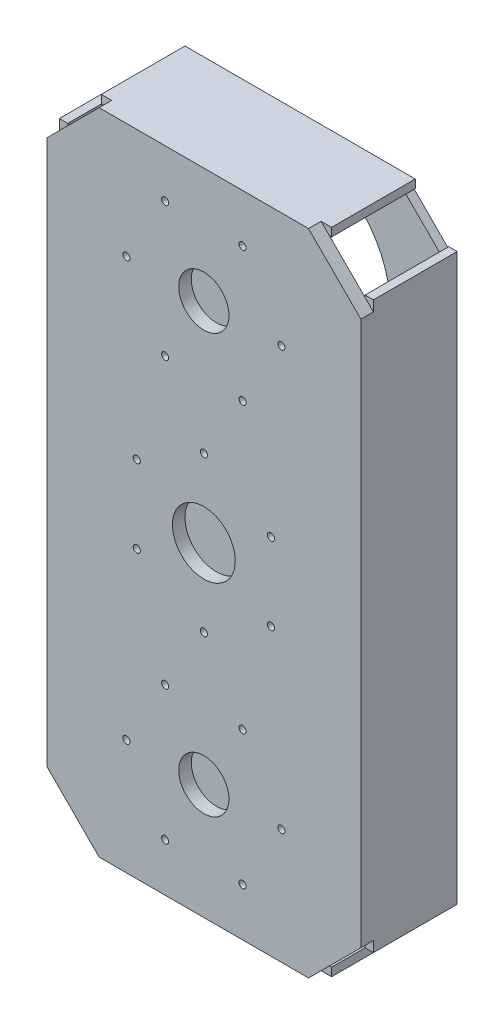
from build123d import *

# Parameters (mm, degrees)
SK_TOP_PLATE_R      = 1.7
SK_TOP_PLATE_R_2    = 12
SK_TOP_PLATE_R_3    = 15
TOP_PLATE_DEPTH     = 6
SK_FRONT_WALL_W     = 40
SK_FRONT_WALL_H     = 270
FRONT_WALL_DEPTH    = 4
SK_BACK_WALL_W      = 40
SK_BACK_WALL_H      = 270
BACK_WALL_DEPTH     = 4
SK_LEFT_WALL_W      = 110
SK_LEFT_WALL_H      = 40
LEFT_WALL_DEPTH     = 4
SK_RIGHT_WALL_W     = 110
SK_RIGHT_WALL_H     = 40
RIGHT_WALL_DEPTH    = 4
SK_BOTTOM_PLATE_R   = 47
SK_BOTTOM_PLATE_R_2 = 20
BOTTOM_PLATE_DEPTH  = 4


with BuildPart() as part:
    # SK_Top_Plate → Top_Plate (new body)
    with BuildSketch(Plane.XY.offset(131)):
        Polygon((-50, -155), (50, -155), (75, -130), (75, 130), (50, 155), (-50, 155), (-75, 130), (-75, -130), align=None)
        with Locations((37, 100)):
            Circle(SK_TOP_PLATE_R, mode=Mode.SUBTRACT)
        with Locations((18.5, 132.04293994)):
            Circle(SK_TOP_PLATE_R, mode=Mode.SUBTRACT)
        with Locations((-18.5, 132.04293994)):
            Circle(SK_TOP_PLATE_R, mode=Mode.SUBTRACT)
        with Locations((-37, 100)):
            Circle(SK_TOP_PLATE_R, mode=Mode.SUBTRACT)
        with Locations((-18.5, 67.95706006)):
            Circle(SK_TOP_PLATE_R, mode=Mode.SUBTRACT)
        with Locations((18.5, 67.95706006)):
            Circle(SK_TOP_PLATE_R, mode=Mode.SUBTRACT)
        with Locations((0, 100)):
            Circle(SK_TOP_PLATE_R_2, mode=Mode.SUBTRACT)
        with Locations((37, -100)):
            Circle(SK_TOP_PLATE_R, mode=Mode.SUBTRACT)
        with Locations((18.5, -67.95706006)):
            Circle(SK_TOP_PLATE_R, mode=Mode.SUBTRACT)
        with Locations((-18.5, -67.95706006)):
            Circle(SK_TOP_PLATE_R, mode=Mode.SUBTRACT)
        with Locations((-37, -100)):
            Circle(SK_TOP_PLATE_R, mode=Mode.SUBTRACT)
        with Locations((-18.5, -132.04293994)):
            Circle(SK_TOP_PLATE_R, mode=Mode.SUBTRACT)
        with Locations((18.5, -132.04293994)):
            Circle(SK_TOP_PLATE_R, mode=Mode.SUBTRACT)
        with Locations((0, -100)):
            Circle(SK_TOP_PLATE_R_2, mode=Mode.SUBTRACT)
        with Locations((32.04293994, 18.5)):
            Circle(SK_TOP_PLATE_R, mode=Mode.SUBTRACT)
        with Locations((0, 37)):
            Circle(SK_TOP_PLATE_R, mode=Mode.SUBTRACT)
        with Locations((-32.04293994, 18.5)):
            Circle(SK_TOP_PLATE_R, mode=Mode.SUBTRACT)
        with Locations((-32.04293994, -18.5)):
            Circle(SK_TOP_PLATE_R, mode=Mode.SUBTRACT)
        with Locations((0, -37)):
            Circle(SK_TOP_PLATE_R, mode=Mode.SUBTRACT)
        with Locations((32.04293994, -18.5)):
            Circle(SK_TOP_PLATE_R, mode=Mode.SUBTRACT)
        Circle(SK_TOP_PLATE_R_3, mode=Mode.SUBTRACT)
    extrude(amount=TOP_PLATE_DEPTH)

    # SK_Front_Wall → Front_Wall (add)
    with BuildSketch(Plane(origin=(71, 0, 0), x_dir=(0, 0, -1), z_dir=(1, 0, 0))):
        with Locations((-111, 0)):
            Rectangle(SK_FRONT_WALL_W, SK_FRONT_WALL_H)
    extrude(amount=FRONT_WALL_DEPTH)

    # SK_Back_Wall → Back_Wall (add)
    with BuildSketch(Plane(origin=(-75, 0, 0), x_dir=(0, 0, -1), z_dir=(1, 0, 0))):
        with Locations((-111, 0)):
            Rectangle(SK_BACK_WALL_W, SK_BACK_WALL_H)
    extrude(amount=BACK_WALL_DEPTH)

    # SK_Left_Wall → Left_Wall (add)
    with BuildSketch(Plane(origin=(0, 151, 0), x_dir=(1, 0, 0), z_dir=(0, 1, 0))):
        with Locations((0, -111)):
            Rectangle(SK_LEFT_WALL_W, SK_LEFT_WALL_H)
    extrude(amount=LEFT_WALL_DEPTH)

    # SK_Right_Wall → Right_Wall (add)
    with BuildSketch(Plane(origin=(0, -155, 0), x_dir=(1, 0, 0), z_dir=(0, 1, 0))):
        with Locations((0, -111)):
            Rectangle(SK_RIGHT_WALL_W, SK_RIGHT_WALL_H)
    extrude(amount=RIGHT_WALL_DEPTH)

    # SK_Bottom_Plate → Bottom_Plate (add)
    with BuildSketch(Plane.XY.offset(91)):
        Polygon((-50, -155), (50, -155), (75, -130), (75, 130), (50, 155), (-50, 155), (-75, 130), (-75, -130), align=None)
        with Locations((0, 100)):
            Circle(SK_BOTTOM_PLATE_R, mode=Mode.SUBTRACT)
        with Locations((0, -100)):
            Circle(SK_BOTTOM_PLATE_R, mode=Mode.SUBTRACT)
        Circle(SK_BOTTOM_PLATE_R_2, mode=Mode.SUBTRACT)
    extrude(amount=BOTTOM_PLATE_DEPTH)


solid = part.part
